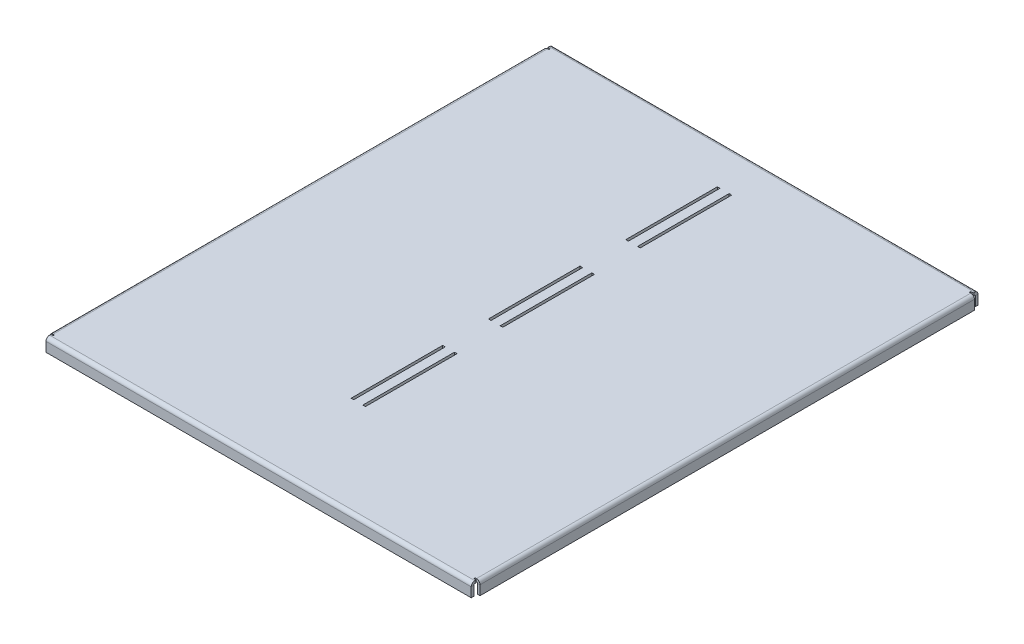
from build123d import *

# Parameters (mm, degrees)
SKETCH1_W                     = 325
SKETCH1_H                     = 10
BASE_FLANGE1_DEPTH            = 2
EDGE_FLANGE1_STRIP_W          = 9.4732
EDGE_FLANGE1_STRIP_H          = 2
EDGE_FLANGE1_STRIP_CUT_DEPTH  = 325
EDGE_FLANGE1_DEPTH            = 325
EDGE_FLANGE2_STRIP_W          = 9.4732
EDGE_FLANGE2_STRIP_H          = 2
EDGE_FLANGE2_STRIP_CUT_DEPTH  = 325
EDGE_FLANGE2_DEPTH            = 325
EDGE_FLANGE3_STRIP_W          = 9.4732
EDGE_FLANGE3_STRIP_H          = 2
EDGE_FLANGE3_STRIP_CUT_DEPTH  = 377.9268
EDGE_FLANGE3_RELIEF_W         = 10.4732
EDGE_FLANGE3_RELIEF_H         = 1
EDGE_FLANGE3_RELIEF_CUT_DEPTH = 2
EDGE_FLANGE3_DEPTH            = 377.9268
EDGE_FLANGE4_STRIP_W          = 9.4732
EDGE_FLANGE4_STRIP_H          = 2
EDGE_FLANGE4_STRIP_CUT_DEPTH  = 377.9268
EDGE_FLANGE4_RELIEF_W         = 10.4732
EDGE_FLANGE4_RELIEF_H         = 1
EDGE_FLANGE4_RELIEF_CUT_DEPTH = 2
EDGE_FLANGE4_DEPTH            = 377.9268
CUT_EXTRUDE1_DEPTH            = 421.997636573
CUT_EXTRUDE1_DEPTH_BACK       = 421.997636573
SKETCH14_W                    = 2
SKETCH14_H                    = 70


# Sheet-metal steps are written as plain solids
with BuildPart() as part:
    # Sketch1 → Base-Flange1 (new body)
    with BuildSketch(Plane.XY):
        Rectangle(SKETCH1_W, SKETCH1_H)
    extrude(amount=-BASE_FLANGE1_DEPTH)

    # Edge-Flange1 strip (across the edge) → Edge-Flange1 strip cut (cut)
    with BuildSketch(Plane(origin=(-162.5, 5, -2), x_dir=(0, -1, 0), z_dir=(1, 0, 0))):
        with Locations((-2, -1)):
            Rectangle(EDGE_FLANGE1_STRIP_W, EDGE_FLANGE1_STRIP_H)
    extrude(amount=EDGE_FLANGE1_STRIP_CUT_DEPTH, mode=Mode.SUBTRACT)

    # Edge-Flange1 section (across the edge) → Edge-Flange1 (add)
    with BuildSketch(Plane(origin=(-162.5, 5, -2), x_dir=(0, -1, 0), z_dir=(1, 0, 0))):
        with BuildLine():
            Line((0, 0.7366), (0, 385.4))
            Line((0, 385.4), (2, 385.4))
            Line((2, 385.4), (2, 0.7366))
            ThreePointArc((2, 0.7366), (2.215745145, 0.215745145), (2.7366, 0))
            Line((2.7366, 0), (2.7366, -2))
            ThreePointArc((2.7366, -2), (0.801531583, -1.198468417), (0, 0.7366))
        make_face()
    extrude(amount=EDGE_FLANGE1_DEPTH)

    # Edge-Flange2 strip (across the edge) → Edge-Flange2 strip cut (cut)
    with BuildSketch(Plane(origin=(-162.5, 3, -387.4), x_dir=(0, 0, 1), z_dir=(1, 0, 0))):
        with Locations((-2, -1)):
            Rectangle(EDGE_FLANGE2_STRIP_W, EDGE_FLANGE2_STRIP_H)
    extrude(amount=EDGE_FLANGE2_STRIP_CUT_DEPTH, mode=Mode.SUBTRACT)

    # Edge-Flange2 section (across the edge) → Edge-Flange2 (add)
    with BuildSketch(Plane(origin=(-162.5, 3, -387.4), x_dir=(0, 0, 1), z_dir=(1, 0, 0))):
        with BuildLine():
            Line((0, 0.7366), (0, 8))
            Line((0, 8), (2, 8))
            Line((2, 8), (2, 0.7366))
            ThreePointArc((2, 0.7366), (2.215745145, 0.215745145), (2.7366, 0))
            Line((2.7366, 0), (2.7366, -2))
            ThreePointArc((2.7366, -2), (0.801531583, -1.198468417), (0, 0.7366))
        make_face()
    extrude(amount=EDGE_FLANGE2_DEPTH)

    # Edge-Flange3 strip (across the edge) → Edge-Flange3 strip cut (cut)
    with BuildSketch(Plane(origin=(162.5, 3, -382.6634), x_dir=(-1, 0, 0), z_dir=(0, 0, 1))):
        with Locations((-4, -1)):
            Rectangle(EDGE_FLANGE3_STRIP_W, EDGE_FLANGE3_STRIP_H)
    extrude(amount=EDGE_FLANGE3_STRIP_CUT_DEPTH, mode=Mode.SUBTRACT)

    # Edge-Flange3 relief (on the sheet) → Edge-Flange3 relief cut (cut)
    with BuildSketch(Plane(origin=(161.7634, 3, -382.6634), x_dir=(-1, 0, 0), z_dir=(0, -1, 0))):
        with Locations((-4.2366, 0.5)):
            Rectangle(EDGE_FLANGE3_RELIEF_W, EDGE_FLANGE3_RELIEF_H)
        with Locations((-4.2366, -378.4268)):
            Rectangle(EDGE_FLANGE3_RELIEF_W, EDGE_FLANGE3_RELIEF_H)
    extrude(amount=-EDGE_FLANGE3_RELIEF_CUT_DEPTH, mode=Mode.SUBTRACT)

    # Edge-Flange3 section (across the edge) → Edge-Flange3 (add)
    with BuildSketch(Plane(origin=(162.5, 3, -382.6634), x_dir=(-1, 0, 0), z_dir=(0, 0, 1))):
        with BuildLine():
            Line((-2, 0.7366), (-2, 8))
            Line((-2, 8), (0, 8))
            Line((0, 8), (0, 0.7366))
            ThreePointArc((0, 0.7366), (0.215745145, 0.215745145), (0.7366, 0))
            Line((0.7366, 0), (0.7366, -2))
            ThreePointArc((0.7366, -2), (-1.198468417, -1.198468417), (-2, 0.7366))
        make_face()
    extrude(amount=EDGE_FLANGE3_DEPTH)

    # Edge-Flange4 strip (across the edge) → Edge-Flange4 strip cut (cut)
    with BuildSketch(Plane(origin=(-162.5, 3, -4.7366), x_dir=(1, 0, 0), z_dir=(0, 0, -1))):
        with Locations((-4, -1)):
            Rectangle(EDGE_FLANGE4_STRIP_W, EDGE_FLANGE4_STRIP_H)
    extrude(amount=EDGE_FLANGE4_STRIP_CUT_DEPTH, mode=Mode.SUBTRACT)

    # Edge-Flange4 relief (on the sheet) → Edge-Flange4 relief cut (cut)
    with BuildSketch(Plane(origin=(-161.7634, 3, -4.7366), x_dir=(1, 0, 0), z_dir=(0, -1, 0))):
        with Locations((-4.2366, 0.5)):
            Rectangle(EDGE_FLANGE4_RELIEF_W, EDGE_FLANGE4_RELIEF_H)
        with Locations((-4.2366, -378.4268)):
            Rectangle(EDGE_FLANGE4_RELIEF_W, EDGE_FLANGE4_RELIEF_H)
    extrude(amount=-EDGE_FLANGE4_RELIEF_CUT_DEPTH, mode=Mode.SUBTRACT)

    # Edge-Flange4 section (across the edge) → Edge-Flange4 (add)
    with BuildSketch(Plane(origin=(-162.5, 3, -4.7366), x_dir=(1, 0, 0), z_dir=(0, 0, -1))):
        with BuildLine():
            Line((-2, 0.7366), (-2, 8))
            Line((-2, 8), (0, 8))
            Line((0, 8), (0, 0.7366))
            ThreePointArc((0, 0.7366), (0.215745145, 0.215745145), (0.7366, 0))
            Line((0.7366, 0), (0.7366, -2))
            ThreePointArc((0.7366, -2), (-1.198468417, -1.198468417), (-2, 0.7366))
        make_face()
    extrude(amount=EDGE_FLANGE4_DEPTH)

    # Sketch14 → Cut-Extrude1 (cut, two sides: drawn at the far end of the back side and taken through both)
    with BuildSketch(Plane(origin=(0, 5, 0), x_dir=(1, 0, 0), z_dir=(0, 1, 0)).offset(-CUT_EXTRUDE1_DEPTH_BACK)):
        with Locations((-4.5, 321.2)):
            Rectangle(SKETCH14_W, SKETCH14_H)
        with Locations((4.5, 321.2)):
            Rectangle(SKETCH14_W, SKETCH14_H)
        with Locations((-4.5, 216.2)):
            Rectangle(SKETCH14_W, SKETCH14_H)
        with Locations((4.5, 216.2)):
            Rectangle(SKETCH14_W, SKETCH14_H)
        with Locations((-4.5, 111.2)):
            Rectangle(SKETCH14_W, SKETCH14_H)
        with Locations((4.5, 111.2)):
            Rectangle(SKETCH14_W, SKETCH14_H)
    extrude(amount=CUT_EXTRUDE1_DEPTH + CUT_EXTRUDE1_DEPTH_BACK, mode=Mode.SUBTRACT)


solid = part.part
